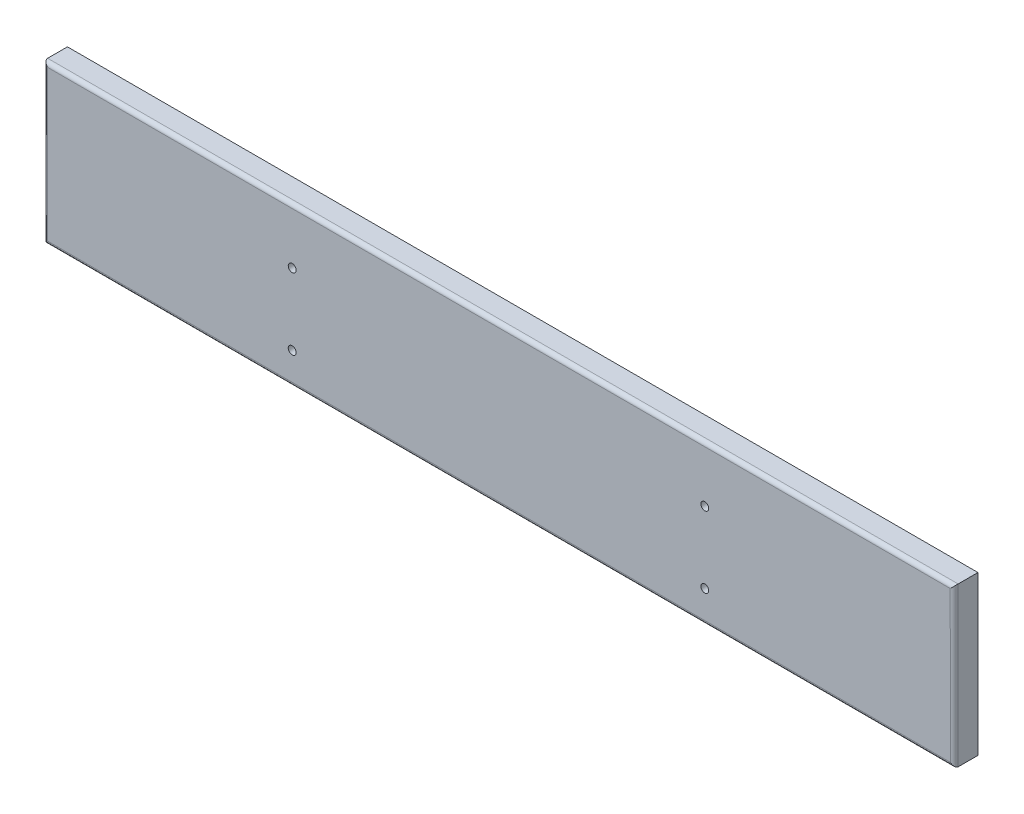
from build123d import *

# Parameters (mm, degrees)
BOSS_EXTRUDE1_DEPTH                  = 19.05
F_1_4_0_25_DIAMETER_HOLE1_AT_2_COUNT = 2
F_1_4_0_25_DIAMETER_HOLE1_AT_2_PITCH = 57.15
F_1_4_0_25_DIAMETER_HOLE1_AT_3_COUNT = 2
F_1_4_0_25_DIAMETER_HOLE1_AT_3_PITCH = 335.810574388
F_1_4_0_25_DIAMETER_HOLE1_AT_4_COUNT = 2
F_1_4_0_25_DIAMETER_HOLE1_AT_4_PITCH = 330.911799988
FILLET1_R                            = 3.175


with BuildPart() as part:
    # Sketch1 → Boss-Extrude1 (new body)
    with BuildSketch(Plane.XY.offset(-348.182458287)):
        Polygon((378.797753528, 164.483362877), (-351.452246472, 164.483362877), (-351.452246472, 37.483362877), (378.838596905, 37.483362877), align=None)
    extrude(amount=BOSS_EXTRUDE1_DEPTH)

    # Sketch5 → 1/4 (0.25) Diameter Hole1 (revolve, cut)
    with BuildSketch(Plane(origin=(-152.13904646, 120.033362877, -329.132458287), x_dir=(0, -1, 0), z_dir=(1, 0, 0))):
        Polygon((0, 0), (0, 19.05), (3.937, 19.05), (3.175, 18.173419274), (3.175, 0), align=None)
    f_1_4_0_25_diameter_hole1 = revolve(axis=Axis((-152.13904646, 120.033362877, -322.782458287), (0, 0, -1)), mode=Mode.SUBTRACT)

    # 1/4 (0.25) Diameter Hole1 at 2: 1/4 (0.25) Diameter Hole1 ×2
    with Locations(*[(0, -i * F_1_4_0_25_DIAMETER_HOLE1_AT_2_PITCH, 0) for i in range(1, F_1_4_0_25_DIAMETER_HOLE1_AT_2_COUNT)]):
        add(f_1_4_0_25_diameter_hole1, mode=Mode.SUBTRACT)

    # 1/4 (0.25) Diameter Hole1 at 3: 1/4 (0.25) Diameter Hole1 ×2
    with Locations(*[Vector(0.9854120901056371, -0.17018523048032, 0) * (i * F_1_4_0_25_DIAMETER_HOLE1_AT_3_PITCH) for i in range(1, F_1_4_0_25_DIAMETER_HOLE1_AT_3_COUNT)]):
        add(f_1_4_0_25_diameter_hole1, mode=Mode.SUBTRACT)

    # 1/4 (0.25) Diameter Hole1 at 4: 1/4 (0.25) Diameter Hole1 ×2
    with Locations(*[(i * F_1_4_0_25_DIAMETER_HOLE1_AT_4_PITCH, 0, 0) for i in range(1, F_1_4_0_25_DIAMETER_HOLE1_AT_4_COUNT)]):
        add(f_1_4_0_25_diameter_hole1, mode=Mode.SUBTRACT)

    # Fillet1
    fillet1_edges = [part.edges().sort_by_distance(p)[0] for p in [
        (-351.452246472, 100.983362877, -329.132458287),
        (13.693175216, 37.483362877, -329.132458287),
        (378.818175216, 100.983362877, -329.132458287),
        (13.672753528, 164.483362877, -329.132458287),
    ]]
    fillet(fillet1_edges, radius=FILLET1_R)


solid = part.part
